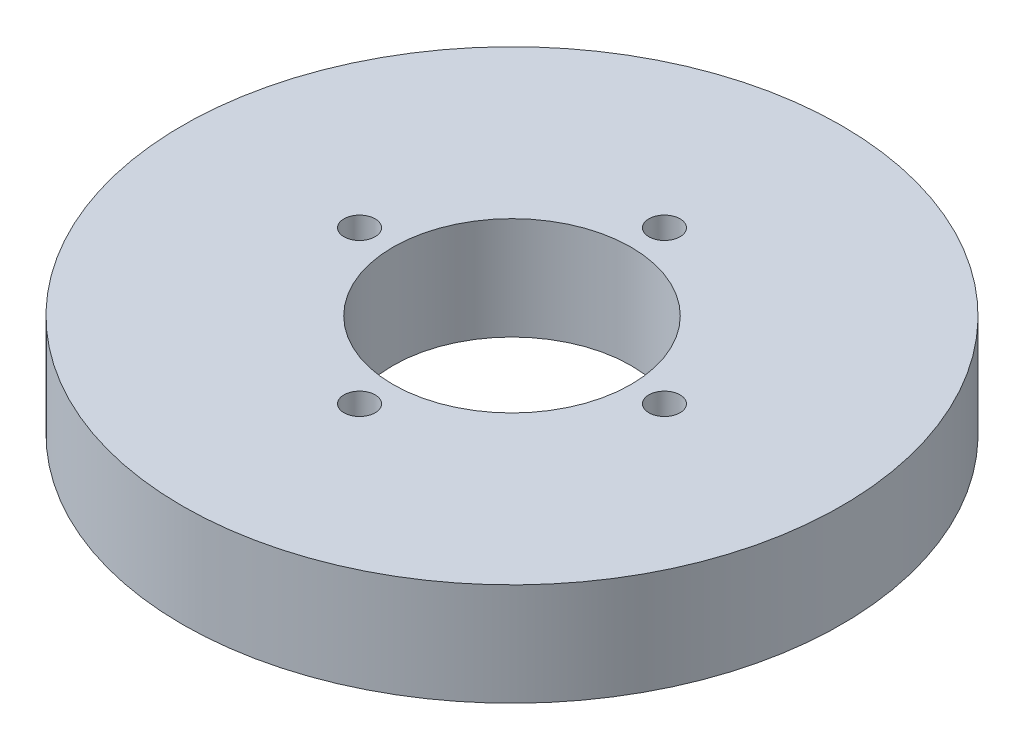
from build123d import *

# Parameters (mm, degrees)
SKETCH1_R           = 90
BOSS_EXTRUDE1_DEPTH = 28
SKETCH2_R           = 32.5
CUT_EXTRUDE1_DEPTH  = 131.322676461
SKETCH3_R           = 4.255865299
CUT_EXTRUDE2_DEPTH  = 18.930154696
CIRPATTERN1_COUNT   = 4


with BuildPart() as part:
    # Sketch1 → Boss-Extrude1 (new body)
    with BuildSketch(Plane(origin=(0, 0, 0), x_dir=(1, 0, 0), z_dir=(0, 1, 0))):
        Circle(SKETCH1_R)
    extrude(amount=BOSS_EXTRUDE1_DEPTH)

    # Sketch2 → Cut-Extrude1 (cut, through all)
    with BuildSketch(Plane(origin=(0, 0, 0), x_dir=(1, 0, 0), z_dir=(0, 1, 0))):
        Circle(SKETCH2_R)
    extrude(amount=CUT_EXTRUDE1_DEPTH, mode=Mode.SUBTRACT)

    # Sketch3 → Cut-Extrude2 (cut)
    with BuildSketch(Plane(origin=(0, 28, 0), x_dir=(1, 0, 0), z_dir=(0, 1, 0))):
        with Locations((-41.6325509, 0)):
            Circle(SKETCH3_R)
    cut_extrude2 = extrude(amount=-CUT_EXTRUDE2_DEPTH, mode=Mode.SUBTRACT)

    # CirPattern1: Cut-Extrude2 ×4 about axis
    cirpattern1_axis = Axis((0, 0, 0), (0, 1, 0))
    for i in range(1, CIRPATTERN1_COUNT):
        add(cut_extrude2.rotate(cirpattern1_axis, i * 360 / CIRPATTERN1_COUNT), mode=Mode.SUBTRACT)


solid = part.part
